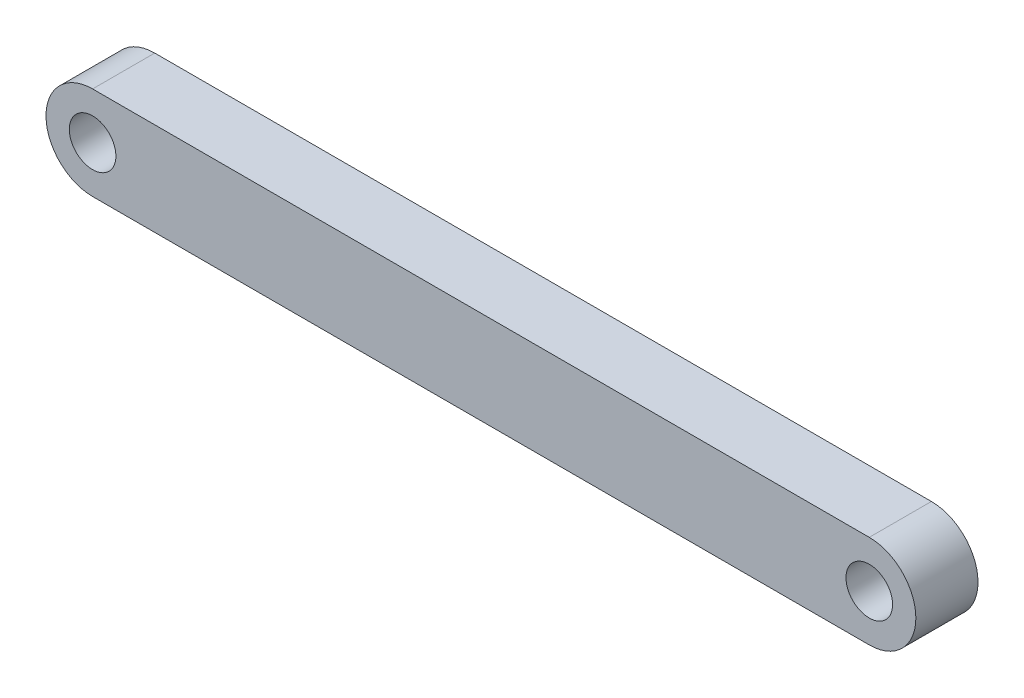
from build123d import *

# Parameters (mm, degrees)
SKETCH1_R           = 1.5
BOSS_EXTRUDE1_DEPTH = 4


with BuildPart() as part:
    # Sketch1 → Boss-Extrude1 (new body)
    with BuildSketch(Plane.XY):
        with BuildLine():
            Line((-25, 3), (25, 3))
            ThreePointArc((25, 3), (28, 0), (25, -3))
            Line((25, -3), (-25, -3))
            ThreePointArc((-25, -3), (-28, 0), (-25, 3))
        make_face()
        with Locations((-25, 0)):
            Circle(SKETCH1_R, mode=Mode.SUBTRACT)
        with Locations((25, 0)):
            Circle(SKETCH1_R, mode=Mode.SUBTRACT)
    extrude(amount=BOSS_EXTRUDE1_DEPTH)


solid = part.part
